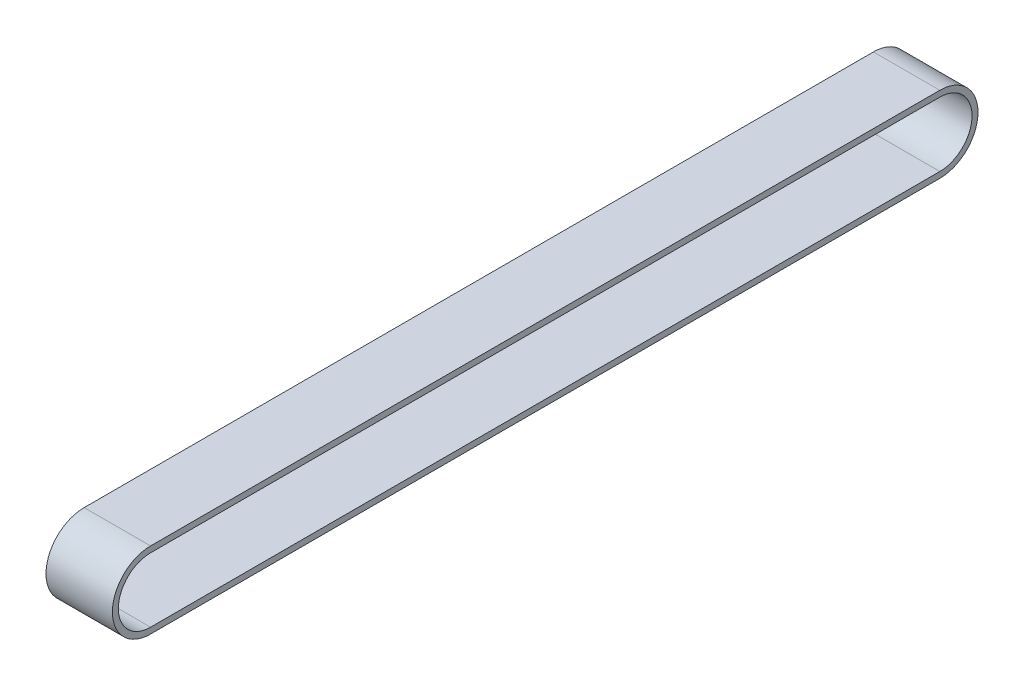
from build123d import *

# Parameters (mm, degrees)
BOSS_EXTRUDE1_DEPTH = 12.7


with BuildPart() as part:
    # Sketch1 → Boss-Extrude1 (new, symmetric)
    with BuildSketch(Plane(origin=(0, 0, 0), x_dir=(0, 0, -1), z_dir=(1, 0, 0))):
        with BuildLine():
            Line((-150.9824006, 14.605), (150.9824006, 14.605))
            ThreePointArc((150.9824006, 14.605), (165.5874006, 0), (150.9824006, -14.605))
            Line((150.9824006, -14.605), (-150.9824006, -14.605))
            ThreePointArc((-150.9824006, -14.605), (-165.5874006, 0), (-150.9824006, 14.605))
        make_face()
        with BuildLine():
            Line((-150.9824006, 12.319), (150.9824006, 12.319))
            ThreePointArc((150.9824006, 12.319), (163.3014006, 0), (150.9824006, -12.319))
            Line((150.9824006, -12.319), (-150.9824006, -12.319))
            ThreePointArc((-150.9824006, -12.319), (-163.3014006, 0), (-150.9824006, 12.319))
        make_face(mode=Mode.SUBTRACT)
    extrude(amount=BOSS_EXTRUDE1_DEPTH, both=True)


solid = part.part
